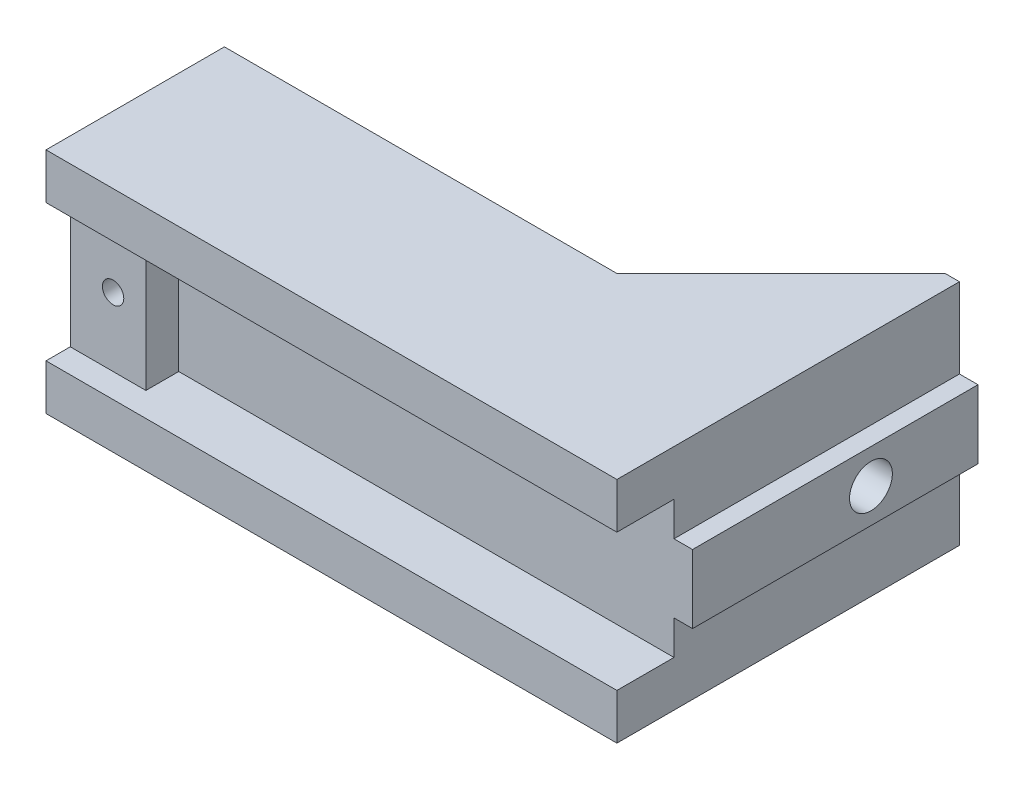
from build123d import *

# Parameters (mm, degrees)
BOSS_EXTRU_1_DEPTH                             = 15
ESQUISSE2_R                                    = 1.2
ENL_V_MAT_EXTRU_1_DEPTH                        = 26.243811123
ESQUISSE3_R                                    = 0.75
ENL_V_MAT_EXTRU_2_DEPTH                        = 20.006577809
ESQUISSE4_R                                    = 1.2
ENL_V_MAT_EXTRU_3_DEPTH                        = 34.470135942
BOSS_EXTRU_2_START                             = 2.3
ESQUISSE5_W                                    = 5.3
ESQUISSE5_H                                    = 9.6
ESQUISSE5_R                                    = 0.75
BOSS_EXTRU_2_DEPTH                             = 2.3
FRAISAGE_POUR_VIS_T_TE_FRAIS_E_M31_D           = 3.2
FRAISAGE_POUR_VIS_T_TE_FRAIS_E_M31_CSINK_D     = 6.3
FRAISAGE_POUR_VIS_T_TE_FRAIS_E_M31_CSINK_ANGLE = 90
ENL_V_MAT_EXTRU_4_DEPTH                        = 2.3
ESQUISSE9_R                                    = 1.2
ENL_V_MAT_EXTRU_5_DEPTH                        = 20.006577853
BOSS_EXTRU_3_DEPTH                             = 16
ESQUISSE11_W                                   = 4
ESQUISSE11_H                                   = 3.2
BOSS_EXTRU_4_DEPTH                             = 10
ESQUISSE14_W                                   = 1.3
ESQUISSE14_H                                   = 4.8
BOSS_EXTRU_5_DEPTH                             = 20
ENL_V_MAT_EXTRU_6_OUTLINE_W                    = 4
ENL_V_MAT_EXTRU_6_OUTLINE_H                    = 9.502069599
ESQUISSE13_R                                   = 1.5
ENL_V_MAT_EXTRU_7_DEPTH                        = 40.865398531


with BuildPart() as part:
    # Esquisse1 → Boss.-Extru.1 (new, symmetric)
    with BuildSketch(Plane(origin=(0, 0, 0), x_dir=(0, 0, -1), z_dir=(1, 0, 0))):
        Polygon((-12.5, -4.8), (-12.5, -8), (0, -8), (0, 8), (-12.5, 8), (-12.5, 4.8), (-8.5, 4.8), (-8.5, -4.8), align=None)
    extrude(amount=BOSS_EXTRU_1_DEPTH, both=True)

    # Esquisse2 → Enlèv. mat.-Extru.1 (cut, through all)
    with BuildSketch(Plane(origin=(0, 8, 0), x_dir=(1, 0, 0), z_dir=(0, 1, 0))):
        with Locations(Location((-7.5, -4, 0), (0, 0, 270))):
            Circle(ESQUISSE2_R)
        with Locations(Location((7.5, -4, 0), (0, 0, 90))):
            Circle(ESQUISSE2_R)
        with Locations(Location((0, -4, 0), (0, 0, 270))):
            Circle(ESQUISSE2_R)
    extrude(amount=-ENL_V_MAT_EXTRU_1_DEPTH, mode=Mode.SUBTRACT)

    # Esquisse3 → Enlèv. mat.-Extru.2 (cut, through all)
    with BuildSketch(Plane.XY.offset(8.5)):
        with Locations((-12, 0)):
            Circle(ESQUISSE3_R)
    extrude(amount=-ENL_V_MAT_EXTRU_2_DEPTH, mode=Mode.SUBTRACT)

    # Esquisse4 → Enlèv. mat.-Extru.3 (cut, through all)
    with BuildSketch(Plane(origin=(15, 0, 0), x_dir=(0, 0, -1), z_dir=(1, 0, 0))):
        with Locations((-4, -4.5)):
            Circle(ESQUISSE4_R)
        with Locations(Location((-4, 4.5, 0), (0, 0, 180))):
            Circle(ESQUISSE4_R)
    extrude(amount=-ENL_V_MAT_EXTRU_3_DEPTH, mode=Mode.SUBTRACT)

    # Esquisse5 → Boss.-Extru.2 (add)
    with BuildSketch(Plane.XY.offset(8.5).offset(BOSS_EXTRU_2_START)):
        with Locations((-12.35, 0)):
            Rectangle(ESQUISSE5_W, ESQUISSE5_H)
        with Locations((-12, 0)):
            Circle(ESQUISSE5_R, mode=Mode.SUBTRACT)
    extrude(amount=-BOSS_EXTRU_2_DEPTH)

    # Fraisage pour vis à tête fraisée M31 (through all)
    with Locations(Plane.XY.offset(8.5)):
        with Locations((0, 0)):
            CounterSinkHole(FRAISAGE_POUR_VIS_T_TE_FRAIS_E_M31_D / 2, FRAISAGE_POUR_VIS_T_TE_FRAIS_E_M31_CSINK_D / 2, counter_sink_angle=FRAISAGE_POUR_VIS_T_TE_FRAIS_E_M31_CSINK_ANGLE)

    # Esquisse8 → Enlèv. mat.-Extru.4 (cut)
    with BuildSketch(Plane(origin=(0, 0, 0), x_dir=(-1, 0, 0), z_dir=(0, 0, -1))):
        Polygon((14.8, 1.616580754), (12, 3.233161507), (9.2, 1.616580754), (9.2, -1.616580754), (12, -3.233161507), (14.8, -1.616580754), align=None)
    extrude(amount=-ENL_V_MAT_EXTRU_4_DEPTH, mode=Mode.SUBTRACT)

    # Esquisse9 → Enlèv. mat.-Extru.5 (cut, through all)
    with BuildSketch(Plane.XY.offset(8.5)):
        with Locations((5, 0)):
            Circle(ESQUISSE9_R)
    extrude(amount=-ENL_V_MAT_EXTRU_5_DEPTH, mode=Mode.SUBTRACT)

    # Esquisse10 → Boss.-Extru.3 (add)
    with BuildSketch(Plane.XZ.offset(8)):
        Polygon((25, 8.5), (-9, 8.5), (-9, 0), (12.5, 0), (24, -11.5), (25, -11.5), align=None)
    extrude(amount=-BOSS_EXTRU_3_DEPTH)

    # Esquisse11 → Boss.-Extru.4 (add)
    with BuildSketch(Plane(origin=(15, 0, 0), x_dir=(0, 0, -1), z_dir=(1, 0, 0))):
        with Locations((-10.5, -6.4)):
            Rectangle(ESQUISSE11_W, ESQUISSE11_H)
        with Locations((-10.5, 6.4)):
            Rectangle(ESQUISSE11_W, ESQUISSE11_H)
    extrude(amount=BOSS_EXTRU_4_DEPTH)

    # Esquisse14 → Boss.-Extru.5 (add)
    with BuildSketch(Plane.XY.offset(8.5)):
        with Locations((25.65, 0)):
            Rectangle(ESQUISSE14_W, ESQUISSE14_H)
    extrude(amount=-BOSS_EXTRU_5_DEPTH)

    # Enlèv. mat.-Extru.6: read off the stored shape, not the designer's step
    # Enlèv. mat.-Extru.6 outline → Enlèv. mat.-Extru.6 (revolve, cut)
    with BuildSketch(Plane.YX.offset(4)):
        with Locations((2, 17.248965201)):
            Rectangle(ENL_V_MAT_EXTRU_6_OUTLINE_W, ENL_V_MAT_EXTRU_6_OUTLINE_H)
    revolve(axis=Axis((0, 0, -4), (1, 0, 0)), mode=Mode.SUBTRACT)

    # Esquisse13 → Enlèv. mat.-Extru.7 (cut, through all)
    with BuildSketch(Plane.ZY.offset(-22)):
        with Locations((-4, 0)):
            Circle(ESQUISSE13_R)
    extrude(amount=-ENL_V_MAT_EXTRU_7_DEPTH, mode=Mode.SUBTRACT)


solid = part.part
